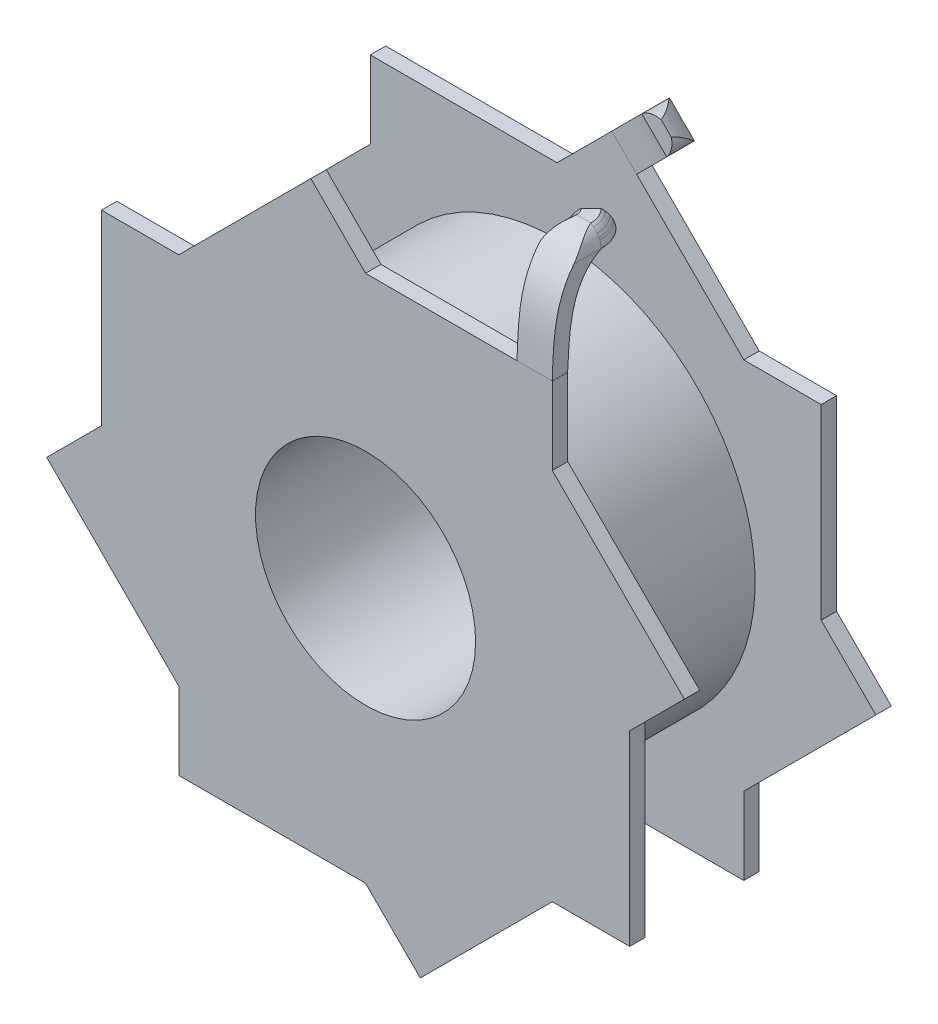
from build123d import *
from build123d.topology import SkipClean

# Parameters (mm, degrees)
SKETCH1_R           = 2.5
BOSS_EXTRUDE1_DEPTH = 0.35
BOSS_EXTRUDE2_START = 4
SKETCH2_R           = 4.5
SKETCH2_R_2         = 2.5
BOSS_EXTRUDE2_DEPTH = 4
BOSS_EXTRUDE3_START = -0.35
SKETCH3_R           = 2.5
BOSS_EXTRUDE3_DEPTH = 0.35
BOSS_EXTRUDE4_DEPTH = 0.8
BOSS_EXTRUDE5_DEPTH = 0.8
CUT_EXTRUDE1_DEPTH  = 1.5
CUT_EXTRUDE3_DEPTH  = 1.5
REVOLVE1_ANGLE      = 45


# Read off the part's stored shape, not the designer's step: Revolve1
with BuildPart() as part:
    # Sketch1 → Boss-Extrude1 (new body)
    with BuildSketch(Plane.XY):
        Polygon((-6, 0), (-6, 4.242640687), (-4.242640687, 4.242640687), (-1.242640687, 7.242640687), (0, 6), (4.242640687, 6), (4.242640687, 4.242640687), (7.242640687, 1.242640687), (6, 0), (6, -4.242640687), (4.242640687, -4.242640687), (1.242640687, -7.242640687), (0, -6), (-4.242640687, -6), (-4.242640687, -4.242640687), (-7.242640687, -1.242640687), align=None)
        Circle(SKETCH1_R, mode=Mode.SUBTRACT)
    extrude(amount=BOSS_EXTRUDE1_DEPTH)

    # Sketch2 → Boss-Extrude2 (add)
    with SkipClean():  # the faces are left unmerged after this step: merging them gives an invalid solid
        with BuildSketch(Plane(origin=(0, 0, 0), x_dir=(-1, 0, 0), z_dir=(0, 0, -1)).offset(BOSS_EXTRUDE2_START)):
            Circle(SKETCH2_R)
            Circle(SKETCH2_R_2, mode=Mode.SUBTRACT)
        extrude(amount=-BOSS_EXTRUDE2_DEPTH)

    # Sketch3 → Boss-Extrude3 (add)
    with SkipClean():  # the faces are left unmerged after this step: merging them gives an invalid solid
        with BuildSketch(Plane.XY.offset(-4).offset(BOSS_EXTRUDE3_START)):
            Polygon((6, 0), (6, 4.242640687), (4.242640687, 4.242640687), (1.242640687, 7.242640687), (0, 6), (-4.242640687, 6), (-4.242640687, 4.242640687), (-7.242640687, 1.242640687), (-6, 0), (-6, -4.242640687), (-4.242640687, -4.242640687), (-1.242640687, -7.242640687), (0, -6), (4.242640687, -6), (4.242640687, -4.242640687), (7.242640687, -1.242640687), align=None)
            Circle(SKETCH3_R, mode=Mode.SUBTRACT)
        extrude(amount=BOSS_EXTRUDE3_DEPTH)

    # Sketch7 → Boss-Extrude4 (add)
    with SkipClean():  # the faces are left unmerged after this step: merging them gives an invalid solid
        with BuildSketch(Plane(origin=(4.24, 0, 0), x_dir=(0, 0, -1), z_dir=(1, 0, 0))):
            with BuildLine():
                Line((-0.35, 6), (0, 6))
                add(Edge.make_bspline(
                    [(0, 6), (0.044523166, 6.688933237), (0.026928632, 7.682048661), (0.764884365, 8.046936554)],
                    knots=[0, 0, 0, 0, 1, 1, 1, 1], degree=3))
                Line((0.764884365, 8.046936554), (0.764884365, 8.432568867))
                add(Edge.make_bspline(
                    [(-0.35, 6), (-0.3265351, 6.510605177), (-0.328970026, 7.48772187), (0.295724978, 8.348528015), (0.764884365, 8.432568867)],
                    knots=[0, 0, 0, 0, 0.535832338, 1, 1, 1, 1], degree=3))
            make_face()
        extrude(amount=-BOSS_EXTRUDE4_DEPTH)

    # Sketch9 → Boss-Extrude5 (add)
    with SkipClean():  # the faces are left unmerged after this step: merging them gives an invalid solid
        with BuildSketch(Plane(origin=(-3, 3, 0), x_dir=(0.7071067811865553, 0.7071067811865398, 0), z_dir=(-0.7071067811865398, 0.7071067811865553, 0))):
            with BuildLine():
                Line((6, 4.349666521), (6, 3.999666521))
                add(Edge.make_bspline(
                    [(6, 3.999666521), (6.688933237, 3.955143355), (7.682048661, 3.972737889), (8.046936554, 3.234782156)],
                    knots=[0, 0, 0, 0, 1, 1, 1, 1], degree=3))
                Line((8.046936554, 3.234782156), (8.432568867, 3.234782156))
                add(Edge.make_bspline(
                    [(6, 4.349666521), (6.510605177, 4.326201622), (7.48772187, 4.328636548), (8.348528015, 3.703941543), (8.432568867, 3.234782156)],
                    knots=[0, 0, 0, 0, 0.535832338, 1, 1, 1, 1], degree=3))
            make_face()
        extrude(amount=-BOSS_EXTRUDE5_DEPTH)

    # Sketch10 → Cut-Extrude1 (cut)
    with SkipClean():  # the faces are left unmerged after this step: merging them gives an invalid solid
        with BuildSketch(Plane.XY):
            with BuildLine():
                Line((3.678600588, 8.432568867), (3.44, 8.432568867))
                Line((3.44, 8.432568867), (3.44, 8.052568867))
                ThreePointArc((3.44, 8.052568867), (3.512834389, 8.271744637), (3.678600588, 8.432568867))
            make_face()
            with BuildLine():
                Line((4.24, 8.432568867), (4.001399412, 8.432568867))
                ThreePointArc((4.001399412, 8.432568867), (4.167165611, 8.271744637), (4.24, 8.052568867))
                Line((4.24, 8.052568867), (4.24, 8.432568867))
            make_face()
        extrude(amount=-CUT_EXTRUDE1_DEPTH, mode=Mode.SUBTRACT)

    # Sketch12 → Cut-Extrude3 (cut)
    with SkipClean():  # the faces are left unmerged after this step: merging them gives an invalid solid
        with BuildSketch(Plane(origin=(0, 0, -4.35), x_dir=(-1, 0, 0), z_dir=(0, 0, -1))):
            with BuildLine():
                Line((-2.962726629, 8.962726629), (-3.131442723, 8.794010535))
                ThreePointArc((-3.131442723, 8.794010535), (-2.900508415, 8.797505035), (-2.694026052, 8.694026052))
                Line((-2.694026052, 8.694026052), (-2.962726629, 8.962726629))
            make_face()
            with BuildLine():
                Line((-3.359695959, 8.565757298), (-3.528412054, 8.397041204))
                Line((-3.528412054, 8.397041204), (-3.259711477, 8.128340627))
                ThreePointArc((-3.259711477, 8.128340627), (-3.36319046, 8.33482299), (-3.359695959, 8.565757298))
            make_face()
        extrude(amount=-CUT_EXTRUDE3_DEPTH, mode=Mode.SUBTRACT)

    # Revolve1 outline → Revolve1 (revolve)
    with SkipClean():  # the faces are left unmerged after this step: merging them gives an invalid solid
        with BuildSketch(Plane(origin=(3.432583134, 0, -0.764884365), x_dir=(1, 0, 0), z_dir=(0, 0, 1))):
            with BuildLine():
                add(Edge.make_bspline(
                    [(0.194392704, 8.397661208), (0.171741377, 8.380090633), (0.150646817, 8.360505272), (0.131318656, 8.339223824)],
                    knots=[0.133748192, 0.133748192, 0.133748192, 0.133748192, 0.318286033, 0.318286033, 0.318286033, 0.318286033], degree=3))
                ThreePointArc((0.131318656, 8.339223824), (0.04572255, 8.206116591), (0.007416866, 8.052568867))
                Line((0.007416866, 8.052568867), (0.007416866, 8.05))
                Line((0.007416866, 8.05), (0.807416866, 8.05))
                Line((0.807416866, 8.05), (0.807416866, 8.052568867))
                ThreePointArc((0.807416866, 8.052568867), (0.796040292, 8.124786712), (0.773962097, 8.19448174))
                add(Edge.make_bspline(
                    [(0.773962097, 8.19448174), (0.764540222, 8.217869205), (0.752668426, 8.240408571)],
                    knots=[0.745735048, 0.745735048, 0.745735048, 1, 1, 1], degree=2))
                Line((0.752668426, 8.240408571), (0.710966725, 8.303416061))
                add(Edge.make_bspline(
                    [(0.710966725, 8.303416061), (0.676374455, 8.351449049), (0.632095195, 8.38835115)],
                    knots=[0, 0, 0, 0.600232212, 0.600232212, 0.600232212], degree=2))
                ThreePointArc((0.632095195, 8.38835115), (0.601334867, 8.411718112), (0.568816277, 8.432568867))
                Line((0.568816277, 8.432568867), (0.246017454, 8.432568867))
                ThreePointArc((0.246017454, 8.432568867), (0.219645119, 8.415943159), (0.194392704, 8.397661208))
            make_face()
        revolve(axis=Axis((3.432583134, 0, -0.764884365), (0, 1, 0)), revolution_arc=REVOLVE1_ANGLE)


solid = part.part
